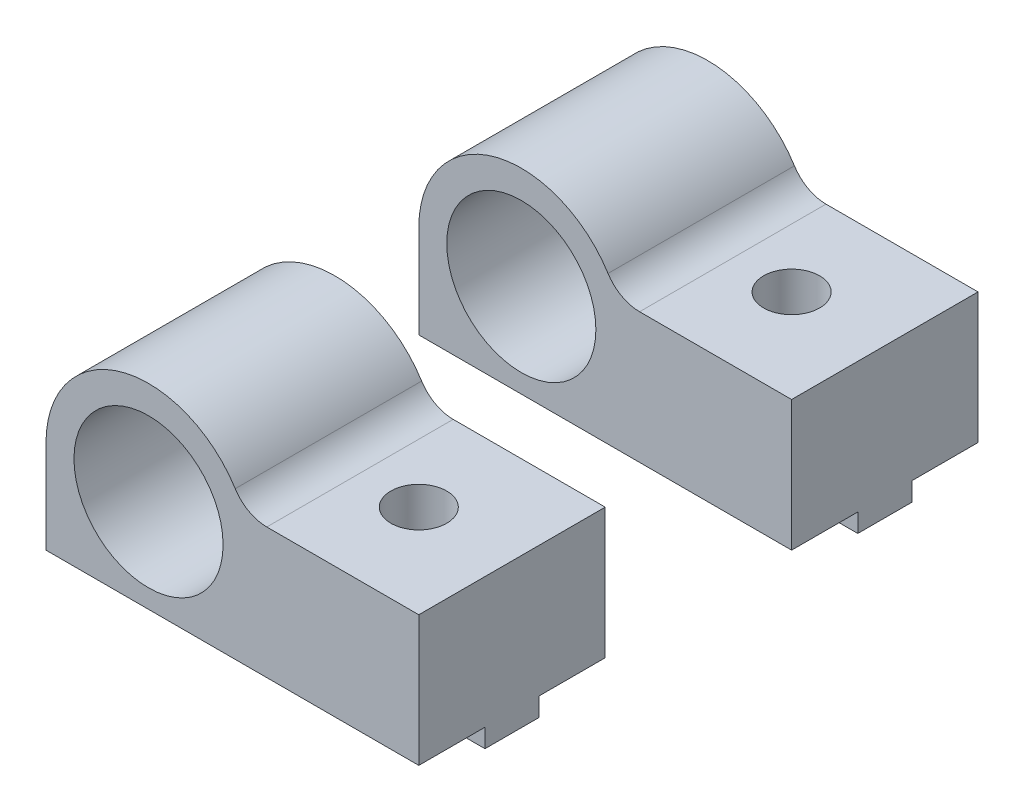
from build123d import *

# Parameters (mm, degrees)
SKETCH1_R                       = 4
MAIN_DEPTH                      = 10
SKETCH3_W                       = 20
SKETCH3_H                       = 2.9
MAKERBEAMRECTANGULARGUIDE_DEPTH = 1
SKETCH4_R                       = 1.5
MAKERBEAMFIXHOLE_DEPTH          = 20.345542122
FILLET1_R                       = 2
LPATTERN1_COUNT                 = 2
LPATTERN1_PITCH                 = 20


with BuildPart() as part:
    # Sketch1 → Main (new body)
    with BuildSketch(Plane.XY):
        with BuildLine():
            Line((-5.5, 0), (-5.5, -5))
            Line((-5.5, -5), (14.5, -5))
            Line((14.5, -5), (14.5, 2))
            Line((14.5, 2), (5.123475383, 2))
            ThreePointArc((5.123475383, 2), (-1.017567048, 5.405049242), (-5.5, 0))
        make_face()
        Circle(SKETCH1_R, mode=Mode.SUBTRACT)
    extrude(amount=MAIN_DEPTH)

    # Sketch3 → MakerBeamRectangularGuide (add)
    with BuildSketch(Plane(origin=(0, -5, 0), x_dir=(-1, 0, 0), z_dir=(0, -1, 0))):
        with Locations((-4.5, -5)):
            Rectangle(SKETCH3_W, SKETCH3_H)
    extrude(amount=MAKERBEAMRECTANGULARGUIDE_DEPTH)

    # Sketch4 → MakerBeamFixHole (cut, through all)
    with BuildSketch(Plane(origin=(0, 2, 0), x_dir=(1, 0, 0), z_dir=(0, 1, 0))):
        with Locations((9.5, -5)):
            Circle(SKETCH4_R)
    extrude(amount=-MAKERBEAMFIXHOLE_DEPTH, mode=Mode.SUBTRACT)

    # Fillet1
    fillet1_edges = [part.edges().sort_by_distance(p)[0] for p in [
        (5.123475383, 2, 5),
    ]]
    fillet(fillet1_edges, radius=FILLET1_R)


with BuildPart() as lpattern1_1:
    # LPattern1: pattern copy
    add(part.part.moved(Location(Vector(0, 0, -1) * (1 * LPATTERN1_PITCH))))


solid = Compound([part.part, lpattern1_1.part])
